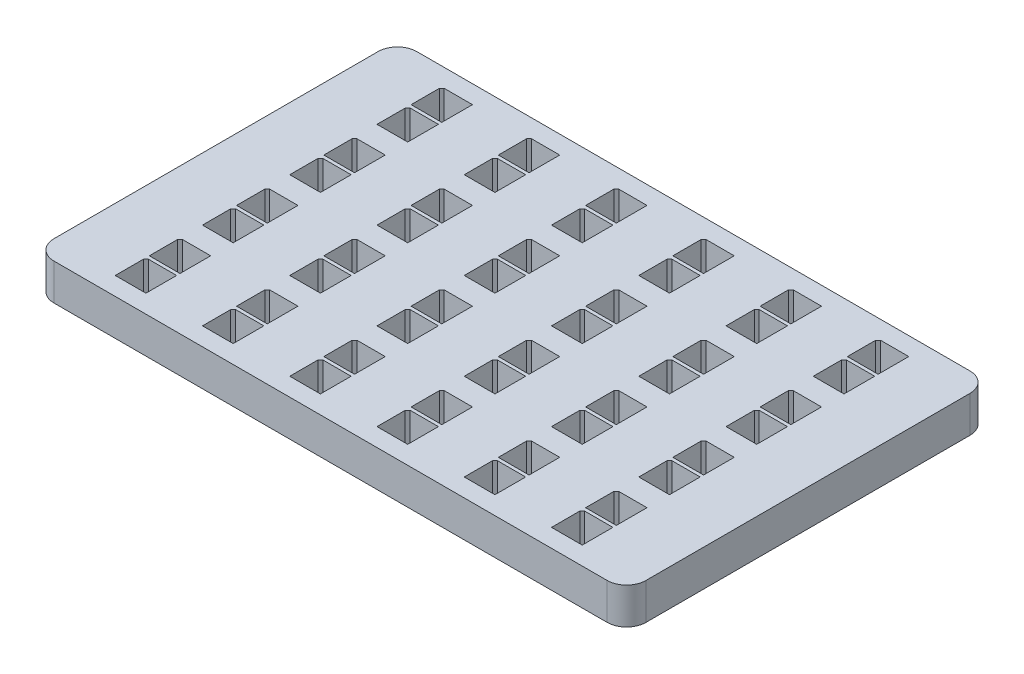
from build123d import *

# Parameters (mm, degrees)
SKETCH1_W           = 122.11
SKETCH1_H           = 74.85
BOSS_EXTRUDE1_DEPTH = 7.5
CUT_EXTRUDE1_DEPTH  = 73.004122451
FILLET1_R           = 4


with BuildPart() as part:
    # Sketch1 → Boss-Extrude1 (new body)
    with BuildSketch(Plane(origin=(0, 0, 0), x_dir=(1, 0, 0), z_dir=(0, 1, 0))):
        Rectangle(SKETCH1_W, SKETCH1_H)
    extrude(amount=BOSS_EXTRUDE1_DEPTH)

    # Sketch2 → Cut-Extrude1 (cut, through all)
    with BuildSketch(Plane(origin=(0, 7.5, 0), x_dir=(1, 0, 0), z_dir=(0, 1, 0))):
        Polygon((-41.835, 33.68), (-41.835, 27.35), (-48.165, 27.35), (-48.165, 33.17116), (-47.65616, 33.68), align=None)
        Polygon((-41.835, 26.65), (-41.835, 20.32), (-48.165, 20.32), (-48.165, 26.14116), (-47.65616, 26.65), align=None)
        Polygon((-23.835, 33.68), (-23.835, 27.35), (-30.165, 27.35), (-30.165, 33.17116), (-29.65616, 33.68), align=None)
        Polygon((-23.835, 26.65), (-23.835, 20.32), (-30.165, 20.32), (-30.165, 26.14116), (-29.65616, 26.65), align=None)
        Polygon((-5.835, 33.68), (-5.835, 27.35), (-12.165, 27.35), (-12.165, 33.17116), (-11.65616, 33.68), align=None)
        Polygon((-5.835, 26.65), (-5.835, 20.32), (-12.165, 20.32), (-12.165, 26.14116), (-11.65616, 26.65), align=None)
        Polygon((12.165, 33.68), (12.165, 27.35), (5.835, 27.35), (5.835, 33.17116), (6.34384, 33.68), align=None)
        Polygon((12.165, 26.65), (12.165, 20.32), (5.835, 20.32), (5.835, 26.14116), (6.34384, 26.65), align=None)
        Polygon((30.165, 33.68), (30.165, 27.35), (23.835, 27.35), (23.835, 33.17116), (24.34384, 33.68), align=None)
        Polygon((30.165, 26.65), (30.165, 20.32), (23.835, 20.32), (23.835, 26.14116), (24.34384, 26.65), align=None)
        Polygon((48.165, 33.68), (48.165, 27.35), (41.835, 27.35), (41.835, 33.17116), (42.34384, 33.68), align=None)
        Polygon((48.165, 26.65), (48.165, 20.32), (41.835, 20.32), (41.835, 26.14116), (42.34384, 26.65), align=None)
        Polygon((-23.835, 15.68), (-23.835, 9.35), (-30.165, 9.35), (-30.165, 15.17116), (-29.65616, 15.68), align=None)
        Polygon((-23.835, 8.65), (-23.835, 2.32), (-30.165, 2.32), (-30.165, 8.14116), (-29.65616, 8.65), align=None)
        Polygon((-5.835, 15.68), (-5.835, 9.35), (-12.165, 9.35), (-12.165, 15.17116), (-11.65616, 15.68), align=None)
        Polygon((-5.835, 8.65), (-5.835, 2.32), (-12.165, 2.32), (-12.165, 8.14116), (-11.65616, 8.65), align=None)
        Polygon((12.165, 15.68), (12.165, 9.35), (5.835, 9.35), (5.835, 15.17116), (6.34384, 15.68), align=None)
        Polygon((12.165, 8.65), (12.165, 2.32), (5.835, 2.32), (5.835, 8.14116), (6.34384, 8.65), align=None)
        Polygon((30.165, 15.68), (30.165, 9.35), (23.835, 9.35), (23.835, 15.17116), (24.34384, 15.68), align=None)
        Polygon((30.165, 8.65), (30.165, 2.32), (23.835, 2.32), (23.835, 8.14116), (24.34384, 8.65), align=None)
        Polygon((48.165, 15.68), (48.165, 9.35), (41.835, 9.35), (41.835, 15.17116), (42.34384, 15.68), align=None)
        Polygon((48.165, 8.65), (48.165, 2.32), (41.835, 2.32), (41.835, 8.14116), (42.34384, 8.65), align=None)
        Polygon((-23.835, -2.32), (-23.835, -8.65), (-30.165, -8.65), (-30.165, -2.82884), (-29.65616, -2.32), align=None)
        Polygon((-23.835, -9.35), (-23.835, -15.68), (-30.165, -15.68), (-30.165, -9.85884), (-29.65616, -9.35), align=None)
        Polygon((-5.835, -2.32), (-5.835, -8.65), (-12.165, -8.65), (-12.165, -2.82884), (-11.65616, -2.32), align=None)
        Polygon((-5.835, -9.35), (-5.835, -15.68), (-12.165, -15.68), (-12.165, -9.85884), (-11.65616, -9.35), align=None)
        Polygon((12.165, -2.32), (12.165, -8.65), (5.835, -8.65), (5.835, -2.82884), (6.34384, -2.32), align=None)
        Polygon((12.165, -9.35), (12.165, -15.68), (5.835, -15.68), (5.835, -9.85884), (6.34384, -9.35), align=None)
        Polygon((30.165, -2.32), (30.165, -8.65), (23.835, -8.65), (23.835, -2.82884), (24.34384, -2.32), align=None)
        Polygon((30.165, -9.35), (30.165, -15.68), (23.835, -15.68), (23.835, -9.85884), (24.34384, -9.35), align=None)
        Polygon((48.165, -2.32), (48.165, -8.65), (41.835, -8.65), (41.835, -2.82884), (42.34384, -2.32), align=None)
        Polygon((48.165, -9.35), (48.165, -15.68), (41.835, -15.68), (41.835, -9.85884), (42.34384, -9.35), align=None)
        Polygon((-23.835, -20.32), (-23.835, -26.65), (-30.165, -26.65), (-30.165, -20.82884), (-29.65616, -20.32), align=None)
        Polygon((-23.835, -27.35), (-23.835, -33.68), (-30.165, -33.68), (-30.165, -27.85884), (-29.65616, -27.35), align=None)
        Polygon((-5.835, -20.32), (-5.835, -26.65), (-12.165, -26.65), (-12.165, -20.82884), (-11.65616, -20.32), align=None)
        Polygon((-5.835, -27.35), (-5.835, -33.68), (-12.165, -33.68), (-12.165, -27.85884), (-11.65616, -27.35), align=None)
        Polygon((12.165, -20.32), (12.165, -26.65), (5.835, -26.65), (5.835, -20.82884), (6.34384, -20.32), align=None)
        Polygon((12.165, -27.35), (12.165, -33.68), (5.835, -33.68), (5.835, -27.85884), (6.34384, -27.35), align=None)
        Polygon((30.165, -20.32), (30.165, -26.65), (23.835, -26.65), (23.835, -20.82884), (24.34384, -20.32), align=None)
        Polygon((30.165, -27.35), (30.165, -33.68), (23.835, -33.68), (23.835, -27.85884), (24.34384, -27.35), align=None)
        Polygon((48.165, -20.32), (48.165, -26.65), (41.835, -26.65), (41.835, -20.82884), (42.34384, -20.32), align=None)
        Polygon((48.165, -27.35), (48.165, -33.68), (41.835, -33.68), (41.835, -27.85884), (42.34384, -27.35), align=None)
        Polygon((-41.835, 15.68), (-41.835, 9.35), (-48.165, 9.35), (-48.165, 15.17116), (-47.65616, 15.68), align=None)
        Polygon((-41.835, 8.65), (-41.835, 2.32), (-48.165, 2.32), (-48.165, 8.14116), (-47.65616, 8.65), align=None)
        Polygon((-41.835, -2.32), (-41.835, -8.65), (-48.165, -8.65), (-48.165, -2.82884), (-47.65616, -2.32), align=None)
        Polygon((-41.835, -9.35), (-41.835, -15.68), (-48.165, -15.68), (-48.165, -9.85884), (-47.65616, -9.35), align=None)
        Polygon((-41.835, -20.32), (-41.835, -26.65), (-48.165, -26.65), (-48.165, -20.82884), (-47.65616, -20.32), align=None)
        Polygon((-41.835, -27.35), (-41.835, -33.68), (-48.165, -33.68), (-48.165, -27.85884), (-47.65616, -27.35), align=None)
    extrude(amount=-CUT_EXTRUDE1_DEPTH, mode=Mode.SUBTRACT)

    # Fillet1
    fillet1_edges = [part.edges().sort_by_distance(p)[0] for p in [
        (61.055, 3.75, 37.425),
        (-61.055, 3.75, 37.425),
        (61.055, 3.75, -37.425),
        (-61.055, 3.75, -37.425),
    ]]
    fillet(fillet1_edges, radius=FILLET1_R)


solid = part.part
